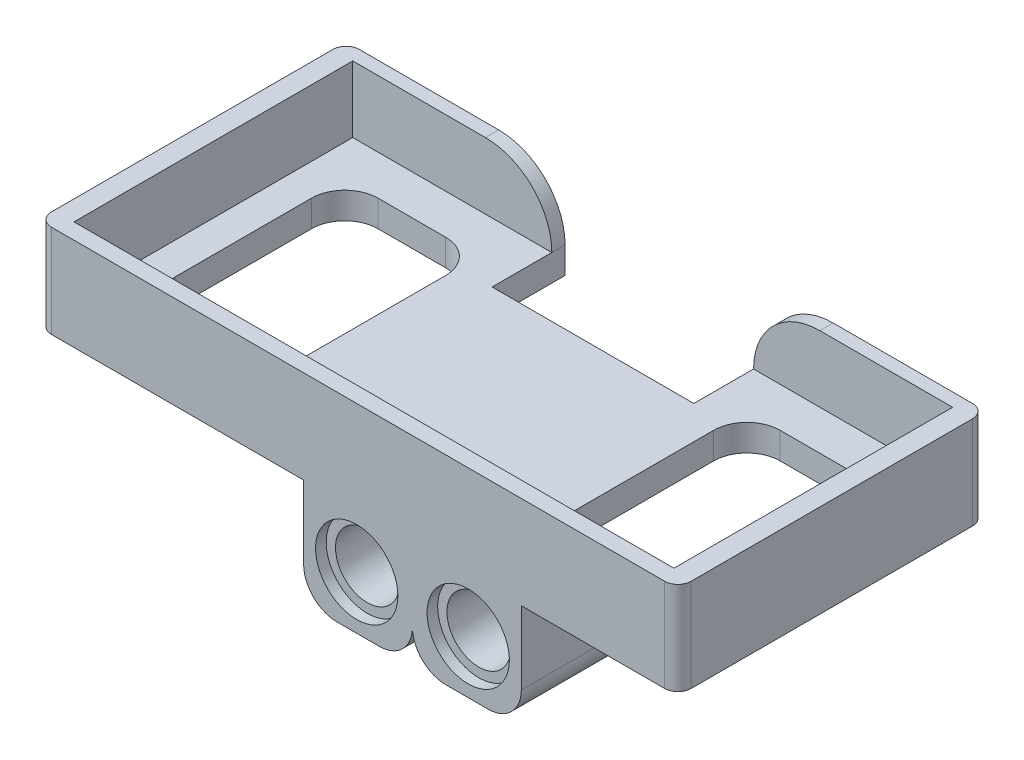
from build123d import *

# Parameters (mm, degrees)
SKETCH1_W           = 48.2
SKETCH1_H           = 23.2
BOSS_EXTRUDE1_DEPTH = 10
SKETCH2_W           = 46.2
SKETCH2_H           = 21.2
CUT_EXTRUDE1_DEPTH  = 8
SKETCH3_W           = 11.2
SKETCH3_H           = 5
CUT_EXTRUDE2_DEPTH  = 10
SKETCH4_W           = 48.2
SKETCH4_H           = 23.2
CUT_EXTRUDE3_DEPTH  = 3
SKETCH5_W           = 8.2
SKETCH5_H           = 7.76
BOSS_EXTRUDE2_DEPTH = 8
SKETCH6_R           = 3.1
CUT_EXTRUDE4_DEPTH  = 0.8
SKETCH7_R           = 2.4
CUT_EXTRUDE5_DEPTH  = 10
SKETCH8_W           = 46.2
SKETCH8_H           = 20.3
CUT_EXTRUDE6_DEPTH  = 5
SKETCH9_W           = 45.4
SKETCH9_H           = 20.3
CUT_EXTRUDE8_DEPTH  = 5
CUT_EXTRUDE9_START  = -0.8
SKETCH10_R          = 3.1
CUT_EXTRUDE9_DEPTH  = 0.8
SKETCH11_W          = 15.2
SKETCH11_H          = 5.5
CUT_EXTRUDE10_DEPTH = 10
CUT_EXTRUDE11_DEPTH = 10
FILLET1_R           = 1
FILLET2_R           = 1
FILLET3_R           = 1
FILLET4_R           = 1
FILLET5_R           = 2.5
FILLET6_R           = 2.5
FILLET7_R           = 5
FILLET8_R           = 5
SKETCH13_W          = 21.2
SKETCH13_H          = 5
BOSS_EXTRUDE3_DEPTH = 0.5
SKETCH14_W          = 21.2
SKETCH14_H          = 5
BOSS_EXTRUDE4_DEPTH = 0.5
SKETCH16_W          = 45.2
SKETCH16_H          = 5
BOSS_EXTRUDE5_DEPTH = 0.2
MIRROR4_START       = 13.310407833
MIRROR4_OUTLINE_R   = 2.4
MIRROR4_DEPTH       = 6.16
MIRROR4_START_2     = 12.510407833
MIRROR4_2_OUTLINE_R = 3.1
MIRROR4_2_DEPTH     = 7.76


# Read off the part's stored shape, not the designer's step: Mirror4
with BuildPart() as part:
    # Sketch1 → Boss-Extrude1 (new body)
    with BuildSketch(Plane(origin=(0, 0, 0), x_dir=(1, 0, 0), z_dir=(0, 1, 0))):
        with Locations((-8.956036835, -8.670407833)):
            Rectangle(SKETCH1_W, SKETCH1_H)
    extrude(amount=BOSS_EXTRUDE1_DEPTH)

    # Sketch2 → Cut-Extrude1 (cut)
    with BuildSketch(Plane(origin=(0, 10, 0), x_dir=(1, 0, 0), z_dir=(0, 1, 0))):
        with Locations((-8.956036835, -8.670407833)):
            Rectangle(SKETCH2_W, SKETCH2_H)
    extrude(amount=-CUT_EXTRUDE1_DEPTH, mode=Mode.SUBTRACT)

    # Sketch3 → Cut-Extrude2 (cut)
    with BuildSketch(Plane(origin=(0, 10, 0), x_dir=(1, 0, 0), z_dir=(0, 1, 0))):
        with Locations((-8.956036835, 0.429592167)):
            Rectangle(SKETCH3_W, SKETCH3_H)
    extrude(amount=-CUT_EXTRUDE2_DEPTH, mode=Mode.SUBTRACT)

    # Sketch4 → Cut-Extrude3 (cut)
    with BuildSketch(Plane(origin=(0, 10, 0), x_dir=(1, 0, 0), z_dir=(0, 1, 0))):
        with Locations((-8.956036835, -8.670407833)):
            Rectangle(SKETCH4_W, SKETCH4_H)
    extrude(amount=-CUT_EXTRUDE3_DEPTH, mode=Mode.SUBTRACT)

    # Sketch5 → Boss-Extrude2 (add)
    with BuildSketch(Plane(origin=(0, 0, 0), x_dir=(-1, 0, 0), z_dir=(0, -1, 0))):
        with Locations((8.956036835, -16.390407833)):
            Rectangle(SKETCH5_W, SKETCH5_H)
    extrude(amount=BOSS_EXTRUDE2_DEPTH)

    # Sketch6 → Cut-Extrude4 (cut)
    with BuildSketch(Plane.XY.offset(20.270407833)):
        with Locations((-9.056036835, -4)):
            Circle(SKETCH6_R)
    extrude(amount=-CUT_EXTRUDE4_DEPTH, mode=Mode.SUBTRACT)

    # Sketch7 → Cut-Extrude5 (cut)
    with BuildSketch(Plane.XY.offset(19.470407833)):
        with Locations((-9.056036835, -4)):
            Circle(SKETCH7_R)
    extrude(amount=-CUT_EXTRUDE5_DEPTH, mode=Mode.SUBTRACT)

    # Sketch8 → Cut-Extrude6 (cut)
    with BuildSketch(Plane(origin=(0, 7, 0), x_dir=(1, 0, 0), z_dir=(0, 1, 0))):
        with Locations((-8.956036835, -8.720407833)):
            Rectangle(SKETCH8_W, SKETCH8_H)
    extrude(amount=-CUT_EXTRUDE6_DEPTH, mode=Mode.SUBTRACT)

    # Sketch9 → Cut-Extrude8 (cut)
    with BuildSketch(Plane(origin=(0, 7, 0), x_dir=(1, 0, 0), z_dir=(0, 1, 0))):
        with Locations((-8.956036835, -8.720407833)):
            Rectangle(SKETCH9_W, SKETCH9_H)
    extrude(amount=-CUT_EXTRUDE8_DEPTH, mode=Mode.SUBTRACT)

    # Sketch10 → Cut-Extrude9 (cut)
    with BuildSketch(Plane(origin=(0, 0, 12.510407833), x_dir=(-1, 0, 0), z_dir=(0, 0, -1)).offset(CUT_EXTRUDE9_START)):
        with Locations(Location((9.056036835, -4, 0), (0, 0, 180))):
            Circle(SKETCH10_R)
    extrude(amount=CUT_EXTRUDE9_DEPTH, mode=Mode.SUBTRACT)

    # Sketch11 → Cut-Extrude10 (cut)
    with BuildSketch(Plane(origin=(0, 7, 0), x_dir=(1, 0, 0), z_dir=(0, 1, 0))):
        with Locations((-8.956036835, 0.179592167)):
            Rectangle(SKETCH11_W, SKETCH11_H)
    extrude(amount=-CUT_EXTRUDE10_DEPTH, mode=Mode.SUBTRACT)

    # Sketch12 → Cut-Extrude11 (cut)
    with BuildSketch(Plane(origin=(0, 2, 0), x_dir=(1, 0, 0), z_dir=(0, 1, 0))):
        with BuildLine():
            Line((8.743963165, -16.370407833), (3.643963165, -16.370407833))
            ThreePointArc((3.643963165, -16.370407833), (1.876196212, -15.638174786), (1.143963165, -13.870407833))
            Line((1.143963165, -13.870407833), (1.143963165, -3.570407833))
            ThreePointArc((1.143963165, -3.570407833), (1.876196212, -1.80264088), (3.643963165, -1.070407833))
            Line((3.643963165, -1.070407833), (8.743963165, -1.070407833))
            ThreePointArc((8.743963165, -1.070407833), (10.511730118, -1.80264088), (11.243963165, -3.570407833))
            Line((11.243963165, -3.570407833), (11.243963165, -13.870407833))
            ThreePointArc((11.243963165, -13.870407833), (10.511730118, -15.638174786), (8.743963165, -16.370407833))
        make_face()
        with BuildLine():
            Line((-21.556036835, -16.370407833), (-26.656036835, -16.370407833))
            ThreePointArc((-26.656036835, -16.370407833), (-28.423803788, -15.638174786), (-29.156036835, -13.870407833))
            Line((-29.156036835, -13.870407833), (-29.156036835, -3.570407833))
            ThreePointArc((-29.156036835, -3.570407833), (-28.423803788, -1.80264088), (-26.656036835, -1.070407833))
            Line((-26.656036835, -1.070407833), (-21.556036835, -1.070407833))
            ThreePointArc((-21.556036835, -1.070407833), (-19.788269882, -1.80264088), (-19.056036835, -3.570407833))
            Line((-19.056036835, -3.570407833), (-19.056036835, -13.870407833))
            ThreePointArc((-19.056036835, -13.870407833), (-19.788269882, -15.638174786), (-21.556036835, -16.370407833))
        make_face()
    extrude(amount=-CUT_EXTRUDE11_DEPTH, mode=Mode.SUBTRACT)

    # Fillet1
    fillet1_edges = [part.edges().sort_by_distance(p)[0] for p in [
        (15.143963165, 3.5, -2.929592167),
    ]]
    fillet(fillet1_edges, radius=FILLET1_R)

    # Fillet2
    fillet2_edges = [part.edges().sort_by_distance(p)[0] for p in [
        (15.143963165, 3.5, 20.270407833),
    ]]
    fillet(fillet2_edges, radius=FILLET2_R)

    # Fillet3
    fillet3_edges = [part.edges().sort_by_distance(p)[0] for p in [
        (-33.056036835, 3.5, 20.270407833),
    ]]
    fillet(fillet3_edges, radius=FILLET3_R)

    # Fillet4
    fillet4_edges = [part.edges().sort_by_distance(p)[0] for p in [
        (-33.056036835, 3.5, -2.929592167),
    ]]
    fillet(fillet4_edges, radius=FILLET4_R)

    # Fillet5
    fillet5_edges = [part.edges().sort_by_distance(p)[0] for p in [
        (-13.056036835, -8, 16.390407833),
    ]]
    fillet(fillet5_edges, radius=FILLET5_R)

    # Fillet6
    fillet6_edges = [part.edges().sort_by_distance(p)[0] for p in [
        (-4.856036835, -8, 16.390407833),
    ]]
    fillet(fillet6_edges, radius=FILLET6_R)

    # Fillet7
    fillet7_edges = [part.edges().sort_by_distance(p)[0] for p in [
        (-1.356036835, 7, -2.429592167),
    ]]
    fillet(fillet7_edges, radius=FILLET7_R)

    # Fillet8
    fillet8_edges = [part.edges().sort_by_distance(p)[0] for p in [
        (-16.556036835, 7, -2.429592167),
    ]]
    fillet(fillet8_edges, radius=FILLET8_R)

    # Sketch13 → Boss-Extrude3 (add)
    with BuildSketch(Plane.ZY.offset(-14.143963165)):
        with Locations((8.670407833, 4.5)):
            Rectangle(SKETCH13_W, SKETCH13_H)
    extrude(amount=BOSS_EXTRUDE3_DEPTH)

    # Sketch14 → Boss-Extrude4 (add)
    with BuildSketch(Plane(origin=(-32.056036835, 0, 0), x_dir=(0, 0, -1), z_dir=(1, 0, 0))):
        with Locations((-8.670407833, 4.5)):
            Rectangle(SKETCH14_W, SKETCH14_H)
    extrude(amount=BOSS_EXTRUDE4_DEPTH)

    # Sketch16 → Boss-Extrude5 (add)
    with BuildSketch(Plane(origin=(0, 0, 19.270407833), x_dir=(-1, 0, 0), z_dir=(0, 0, -1))):
        with Locations((8.956036835, 4.5)):
            Rectangle(SKETCH16_W, SKETCH16_H)
    extrude(amount=BOSS_EXTRUDE5_DEPTH)

    # Mirror4 outline → Mirror4 (add)
    with BuildSketch(Plane.XY.offset(MIRROR4_START)):
        with BuildLine():
            ThreePointArc((-4.856036835, -5.5), (-4.123803788, -7.267766953), (-2.356036835, -8))
            Line((-2.356036835, -8), (0.843963165, -8))
            ThreePointArc((0.843963165, -8), (2.611730118, -7.267766953), (3.343963165, -5.5))
            Line((3.343963165, -5.5), (3.343963165, 0))
            Line((3.343963165, 0), (-4.856036835, 0))
            Line((-4.856036835, 0), (-4.856036835, -5.5))
        make_face()
        with Locations((-0.656036835, -4)):
            Circle(MIRROR4_OUTLINE_R, mode=Mode.SUBTRACT)
    extrude(amount=MIRROR4_DEPTH)

    # Mirror4 2 outline → Mirror4 2 (add)
    with BuildSketch(Plane.XY.offset(MIRROR4_START_2)):
        with BuildLine():
            ThreePointArc((-4.856036835, -5.5), (-4.123803788, -7.267766953), (-2.356036835, -8))
            Line((-2.356036835, -8), (0.843963165, -8))
            ThreePointArc((0.843963165, -8), (2.611730118, -7.267766953), (3.343963165, -5.5))
            Line((3.343963165, -5.5), (3.343963165, 0))
            Line((3.343963165, 0), (-4.856036835, 0))
            Line((-4.856036835, 0), (-4.856036835, -5.5))
        make_face()
        with Locations((-0.656036835, -4)):
            Circle(MIRROR4_2_OUTLINE_R, mode=Mode.SUBTRACT)
    extrude(amount=MIRROR4_2_DEPTH)


solid = part.part
